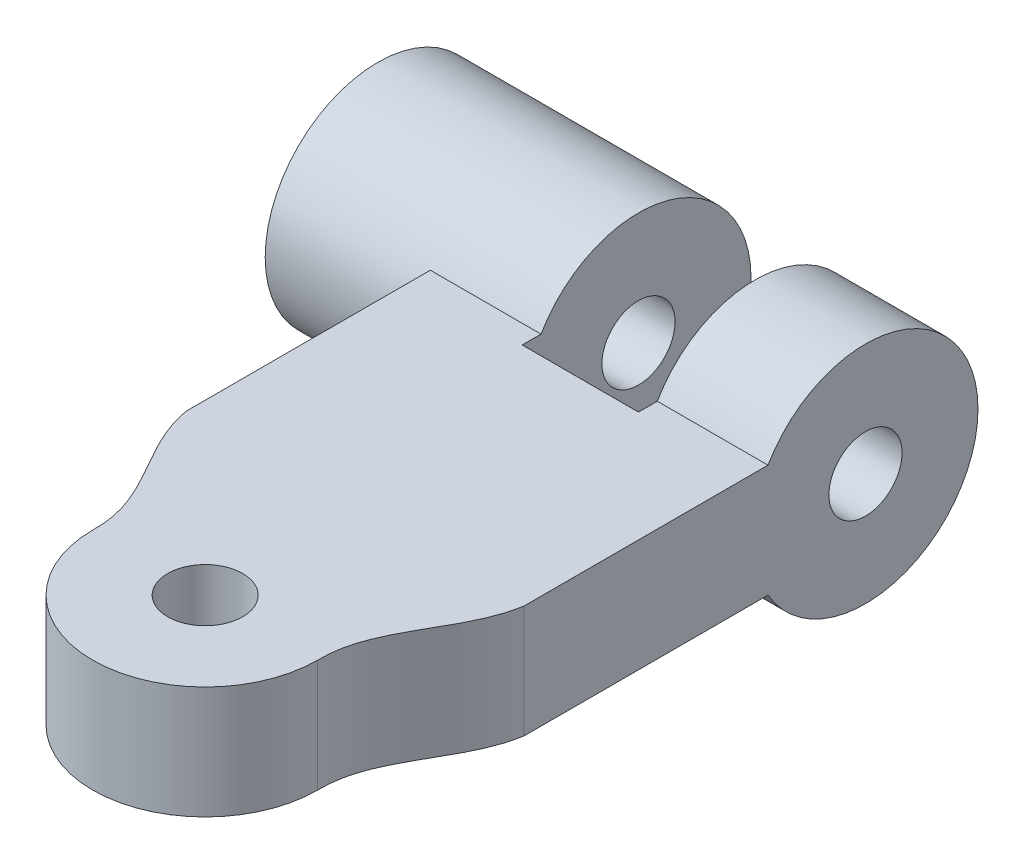
from build123d import *

# Parameters (mm, degrees)
SKETCH1_W           = 9
SKETCH1_H           = 9
BOSS_EXTRUDE1_DEPTH = 3
SKETCH2_W           = 2.95
SKETCH2_H           = 6
BOSS_EXTRUDE2_DEPTH = 6.1
FILLET1_R           = 3
SKETCH3_R           = 0.975
CUT_EXTRUDE1_DEPTH  = 11.1
CUT_EXTRUDE3_DEPTH  = 21.1
BOSS_EXTRUDE3_START = 4
SKETCH5_R           = 3
BOSS_EXTRUDE3_DEPTH = 4
SKETCH8_R           = 1.55
CUT_EXTRUDE4_DEPTH  = 3
CUT_EXTRUDE5_DEPTH  = 0.5
SKETCH10_W          = 9
SKETCH10_H          = 3
BOSS_EXTRUDE4_DEPTH = 4
SKETCH11_R          = 1
CUT_EXTRUDE6_DEPTH  = 4
CUT_EXTRUDE7_DEPTH  = 4


with BuildPart() as part:
    # Sketch1 → Boss-Extrude1 (new body)
    with BuildSketch(Plane(origin=(0, 0, 0), x_dir=(1, 0, 0), z_dir=(0, 1, 0))):
        with Locations((4.5, 4.5)):
            Rectangle(SKETCH1_W, SKETCH1_H)
    extrude(amount=BOSS_EXTRUDE1_DEPTH)

    # Sketch2 → Boss-Extrude2 (add)
    with BuildSketch(Plane(origin=(0, 0, -9), x_dir=(-1, 0, 0), z_dir=(0, 0, -1))):
        with Locations((-7.525, 1.5)):
            Rectangle(SKETCH2_W, SKETCH2_H)
        with Locations((-1.475, 1.5)):
            Rectangle(SKETCH2_W, SKETCH2_H)
    extrude(amount=BOSS_EXTRUDE2_DEPTH)

    # Fillet1
    fillet1_edges = [part.edges().sort_by_distance(p)[0] for p in [
        (1.475, 4.5, -15.1),
        (1.475, -1.5, -15.1),
        (7.525, -1.5, -15.1),
        (7.525, 4.5, -15.1),
    ]]
    fillet(fillet1_edges, radius=FILLET1_R - 0.0001)  # a hair under: the kernel refuses the full size

    # Sketch3 → Cut-Extrude1 (cut)
    with BuildSketch(Plane(origin=(9, 0, 0), x_dir=(0, 0, -1), z_dir=(1, 0, 0))):
        with Locations((12.1, 1.5)):
            Circle(SKETCH3_R)
    extrude(amount=-CUT_EXTRUDE1_DEPTH, mode=Mode.SUBTRACT)

    # Sketch6 → Cut-Extrude3 (cut)
    with BuildSketch(Plane.ZY):
        with BuildLine():
            Line((-12.1, 4.5), (-9, 4.5))
            Line((-9, 4.5), (-9, 3))
            Line((-9, 3), (-9.501923789, 3))
            ThreePointArc((-9.501923789, 3), (-10.6, 4.098076211), (-12.1, 4.5))
        make_face()
        with BuildLine():
            Line((-12.1, -1.5), (-9, -1.5))
            Line((-9, -1.5), (-9, 0))
            Line((-9, 0), (-9.501923789, 0))
            ThreePointArc((-9.501923789, 0), (-10.6, -1.098076211), (-12.1, -1.5))
        make_face()
    extrude(amount=-CUT_EXTRUDE3_DEPTH, mode=Mode.SUBTRACT)

    # Sketch5 → Boss-Extrude3 (add)
    with BuildSketch(Plane.ZY.offset(BOSS_EXTRUDE3_START)):
        with Locations((-12.1, 1.5)):
            Circle(SKETCH5_R)
    extrude(amount=-BOSS_EXTRUDE3_DEPTH)

    # Sketch8 → Cut-Extrude4 (cut)
    with BuildSketch(Plane(origin=(0, -1.5, 0), x_dir=(-1, 0, 0), z_dir=(0, -1, 0))):
        with Locations(Location((1.6, 12.1, 0), (0, 0, 90))):
            Circle(SKETCH8_R)
    extrude(amount=-CUT_EXTRUDE4_DEPTH, mode=Mode.SUBTRACT)

    # Sketch9 → Cut-Extrude5 (cut)
    with BuildSketch(Plane.ZY.offset(4)):
        with BuildLine():
            Line((-11.85, 1.5), (-11.85, -0.8))
            ThreePointArc((-11.85, -0.8), (-12.1, -1.05), (-12.35, -0.8))
            Line((-12.35, -0.8), (-12.35, 0.896446609))
            Line((-12.35, 0.896446609), (-13.549568901, -0.303122292))
            ThreePointArc((-13.549568901, -0.303122292), (-13.903122292, -0.303122292), (-13.903122292, 0.050431099))
            Line((-13.903122292, 0.050431099), (-12.703553391, 1.25))
            Line((-12.703553391, 1.25), (-14.4, 1.25))
            ThreePointArc((-14.4, 1.25), (-14.65, 1.5), (-14.4, 1.75))
            Line((-14.4, 1.75), (-12.703553391, 1.75))
            Line((-12.703553391, 1.75), (-13.903122292, 2.949568901))
            ThreePointArc((-13.903122292, 2.949568901), (-13.903122292, 3.303122292), (-13.549568901, 3.303122292))
            Line((-13.549568901, 3.303122292), (-12.35, 2.103553391))
            Line((-12.35, 2.103553391), (-12.35, 3.8))
            ThreePointArc((-12.35, 3.8), (-12.1, 4.05), (-11.85, 3.8))
            Line((-11.85, 3.8), (-11.85, 1.5))
        make_face()
    extrude(amount=-CUT_EXTRUDE5_DEPTH, mode=Mode.SUBTRACT)

    # Sketch10 → Boss-Extrude4 (add)
    with BuildSketch(Plane.XY):
        with Locations((4.5, 1.5)):
            Rectangle(SKETCH10_W, SKETCH10_H)
    extrude(amount=BOSS_EXTRUDE4_DEPTH)

    # Sketch11 → Cut-Extrude6 (cut)
    with BuildSketch(Plane(origin=(0, 3, 0), x_dir=(1, 0, 0), z_dir=(0, 1, 0))):
        with Locations(Location((4.5, -1, 0), (0, 0, 270))):
            Circle(SKETCH11_R)
    extrude(amount=-CUT_EXTRUDE6_DEPTH, mode=Mode.SUBTRACT)

    # Sketch12 → Cut-Extrude7 (cut)
    with BuildSketch(Plane(origin=(0, 3, 0), x_dir=(1, 0, 0), z_dir=(0, 1, 0))):
        with BuildLine():
            add(Edge.make_bspline(
                [(1.5, -1), (1.53988428, 0.555027292), (0.235256098, 1.545486909), (0, 3)],
                knots=[0, 0, 0, 0, 1, 1, 1, 1], degree=3))
            Line((0, 3), (0, -4))
            Line((0, -4), (4.5, -4))
            ThreePointArc((4.5, -4), (2.378679656, -3.121320344), (1.5, -1))
        make_face()
        with BuildLine():
            ThreePointArc((7.5, -1), (6.621320344, -3.121320344), (4.5, -4))
            Line((4.5, -4), (9, -4))
            Line((9, -4), (9, 3))
            add(Edge.make_bspline(
                [(7.5, -1), (7.46011572, 0.555027292), (8.764743902, 1.545486909), (9, 3)],
                knots=[0, 0, 0, 0, 1, 1, 1, 1], degree=3))
        make_face()
    extrude(amount=-CUT_EXTRUDE7_DEPTH, mode=Mode.SUBTRACT)


solid = part.part
